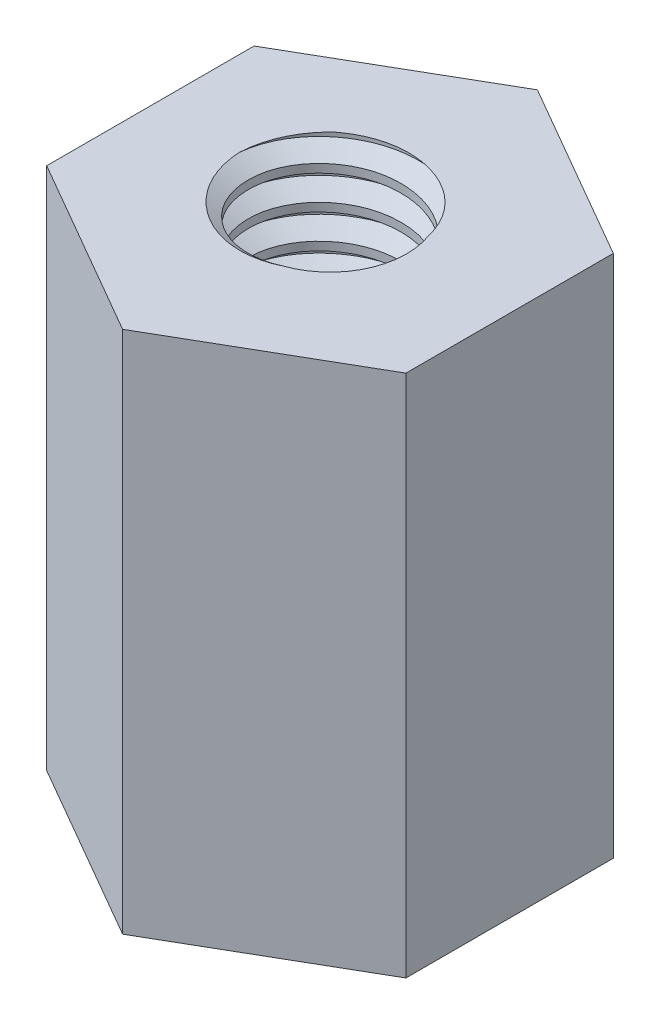
from build123d import *

# Parameters (mm, degrees)
SKETCH1_R           = 1.025
BOSS_EXTRUDE1_DEPTH = 7
THREAD1_PITCH       = 0.45


with BuildPart() as part:
    # Sketch1 → Boss-Extrude1 (new body)
    with BuildSketch(Plane(origin=(0, 0, 0), x_dir=(1, 0, 0), z_dir=(0, 1, 0))):
        Polygon((2.4, 1.385640646), (0, 2.771281292), (-2.4, 1.385640646), (-2.4, -1.385640646), (0, -2.771281292), (2.4, -1.385640646), align=None)
        with Locations(Location((0, 0, 0), (0, 0, 270))):
            Circle(SKETCH1_R, mode=Mode.SUBTRACT)
    extrude(amount=BOSS_EXTRUDE1_DEPTH)

    # Thread1: the profile of Thread Profile1 profile screwed along a right-hand helix of 26.666667 turns, 6 arcs to a turn; built about Z, then put on its axis
    thread1_z = Axis((0, 0, 0), (0, 0, 1))
    thread1_corners = [(1.0247, 0, -0.000173205), (1.268569644, 0, 0.140624999), (1.268569644, 0, 0.196874999), (1.0247, 0, 0.337673204)]
    with BuildLine(mode=Mode.PRIVATE) as thread1_profile:
        Line(thread1_corners[0], thread1_corners[1])
        Line(thread1_corners[1], thread1_corners[2])
        Line(thread1_corners[2], thread1_corners[3])
        Line(thread1_corners[3], thread1_corners[0])
    thread1_cap = Face(thread1_profile.wire())
    thread1_turn_angles = [0, 30, 60, 90, 120, 150, 180, 210, 240, 270, 300, 330, 360]
    thread1_turn_weights = [1, 0.8660254037844387, 1, 0.8660254037844387, 1, 0.8660254037844387, 1, 0.8660254037844387, 1, 0.8660254037844387, 1, 0.8660254037844387, 1]
    thread1_turn_rails = [Edge.make_bspline([Vector(p[0], p[1], 0).rotate(thread1_z, thread1_turn_angles[k]) / thread1_turn_weights[k] + Vector(0, 0, p[2] + THREAD1_PITCH * thread1_turn_angles[k] / 360) for k in range(13)], [0, 0, 0, 1, 1, 2, 2, 3, 3, 4, 4, 5, 5, 6, 6, 6], 2, thread1_turn_weights) for p in thread1_corners]
    thread1_turn_sides = [Face.make_surface_from_curves(thread1_turn_rails[p[0]], thread1_turn_rails[p[1]]) for p in [(0, 1), (1, 2), (2, 3), (3, 0)]]
    thread1_last_angles = [9360, 9390, 9420, 9450, 9480, 9510, 9540, 9570, 9600]
    thread1_last_weights = [1, 0.8660254037844387, 1, 0.8660254037844387, 1, 0.8660254037844387, 1, 0.8660254037844307, 1]
    thread1_last_rails = [Edge.make_bspline([Vector(p[0], p[1], 0).rotate(thread1_z, thread1_last_angles[k]) / thread1_last_weights[k] + Vector(0, 0, p[2] + THREAD1_PITCH * thread1_last_angles[k] / 360) for k in range(9)], [0, 0, 0, 1, 1, 2, 2, 3, 3, 4, 4, 4], 2, thread1_last_weights) for p in thread1_corners]
    thread1_last_sides = [Face.make_surface_from_curves(thread1_last_rails[p[0]], thread1_last_rails[p[1]]) for p in [(0, 1), (1, 2), (2, 3), (3, 0)]]
    thread1 = Plane(origin=(0, 9, 0), x_dir=(-1, 0, 0), z_dir=(0, -1, 0)) * Solid(Shell([*[p.moved(Location((0, 0, THREAD1_PITCH * i))) for i in range(26) for p in thread1_turn_sides], *thread1_last_sides, thread1_cap, thread1_cap.rotate(thread1_z, 9600).moved(Location((0, 0, THREAD1_PITCH * 9600 / 360)))]))
    add(thread1, mode=Mode.SUBTRACT)


solid = part.part
